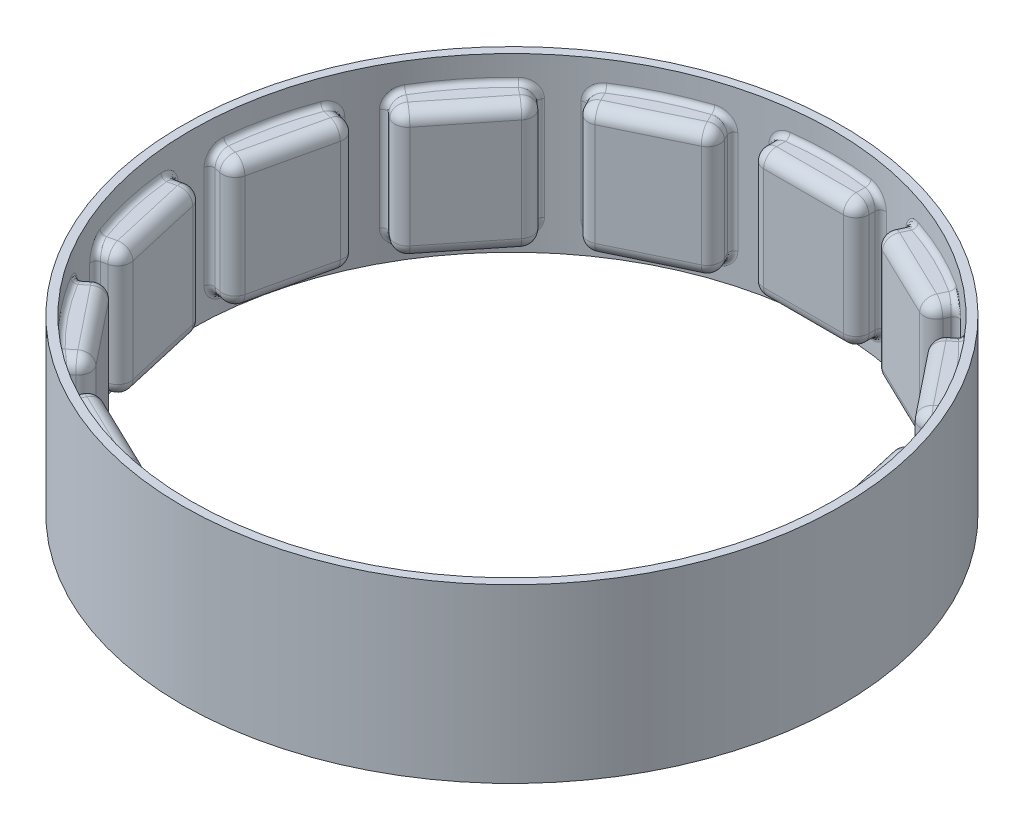
from build123d import *

# Parameters (mm, degrees)
SKETCH1_R           = 12.83
SKETCH1_R_2         = 12.5
BOSS_EXTRUDE1_DEPTH = 6.7
BOSS_EXTRUDE2_START = -1
SKETCH2_W           = 4.1
SKETCH2_H           = 1.2
BOSS_EXTRUDE2_DEPTH = 5
FILLET1_R           = 0.5
CIRPATTERN1_COUNT   = 14
FILLET2_R           = 0.2


with BuildPart() as part:
    # Sketch1 → Boss-Extrude1 (new body)
    with BuildSketch(Plane(origin=(0, 0, 0), x_dir=(1, 0, 0), z_dir=(0, 1, 0))):
        Circle(SKETCH1_R)
        Circle(SKETCH1_R_2, mode=Mode.SUBTRACT)
    extrude(amount=BOSS_EXTRUDE1_DEPTH)


with BuildPart() as body_2:
    # Sketch2 → Boss-Extrude2 (new body)
    with BuildSketch(Plane(origin=(0, 6.7, 0), x_dir=(1, 0, 0), z_dir=(0, 1, 0)).offset(BOSS_EXTRUDE2_START)):
        with Locations((0, 11.949163809)):
            Rectangle(SKETCH2_W, SKETCH2_H)
    extrude(amount=-BOSS_EXTRUDE2_DEPTH)

    # Fillet1
    fillet1_edges = [body_2.edges().sort_by_distance(p)[0] for p in [
        (2.05, 3.2, -11.349163809),
        (0, 0.7, -11.349163809),
        (-2.05, 3.2, -11.349163809),
        (0, 5.7, -11.349163809),
        (-2.05, 0.7, -11.949163809),
        (-2.05, 5.7, -11.949163809),
        (2.05, 0.7, -11.949163809),
        (2.05, 5.7, -11.949163809),
    ]]
    fillet(fillet1_edges, radius=FILLET1_R)


with BuildPart() as cirpattern1_1:
    # CirPattern1: pattern copy
    add(body_2.part.rotate(Axis((0, 6.7, 0), (0, -1, 0)), 1 * 360 / CIRPATTERN1_COUNT))


with BuildPart() as cirpattern1_2:
    # CirPattern1: pattern copy
    add(body_2.part.rotate(Axis((0, 6.7, 0), (0, -1, 0)), 2 * 360 / CIRPATTERN1_COUNT))


with BuildPart() as cirpattern1_3:
    # CirPattern1: pattern copy
    add(body_2.part.rotate(Axis((0, 6.7, 0), (0, -1, 0)), 3 * 360 / CIRPATTERN1_COUNT))


with BuildPart() as cirpattern1_4:
    # CirPattern1: pattern copy
    add(body_2.part.rotate(Axis((0, 6.7, 0), (0, -1, 0)), 4 * 360 / CIRPATTERN1_COUNT))


with BuildPart() as cirpattern1_5:
    # CirPattern1: pattern copy
    add(body_2.part.rotate(Axis((0, 6.7, 0), (0, -1, 0)), 5 * 360 / CIRPATTERN1_COUNT))


with BuildPart() as cirpattern1_6:
    # CirPattern1: pattern copy
    add(body_2.part.rotate(Axis((0, 6.7, 0), (0, -1, 0)), 6 * 360 / CIRPATTERN1_COUNT))


with BuildPart() as cirpattern1_7:
    # CirPattern1: pattern copy
    add(body_2.part.rotate(Axis((0, 6.7, 0), (0, -1, 0)), 7 * 360 / CIRPATTERN1_COUNT))


with BuildPart() as cirpattern1_8:
    # CirPattern1: pattern copy
    add(body_2.part.rotate(Axis((0, 6.7, 0), (0, -1, 0)), 8 * 360 / CIRPATTERN1_COUNT))


with BuildPart() as cirpattern1_9:
    # CirPattern1: pattern copy
    add(body_2.part.rotate(Axis((0, 6.7, 0), (0, -1, 0)), 9 * 360 / CIRPATTERN1_COUNT))


with BuildPart() as cirpattern1_10:
    # CirPattern1: pattern copy
    add(body_2.part.rotate(Axis((0, 6.7, 0), (0, -1, 0)), 10 * 360 / CIRPATTERN1_COUNT))


with BuildPart() as cirpattern1_11:
    # CirPattern1: pattern copy
    add(body_2.part.rotate(Axis((0, 6.7, 0), (0, -1, 0)), 11 * 360 / CIRPATTERN1_COUNT))


with BuildPart() as cirpattern1_12:
    # CirPattern1: pattern copy
    add(body_2.part.rotate(Axis((0, 6.7, 0), (0, -1, 0)), 12 * 360 / CIRPATTERN1_COUNT))


with BuildPart() as cirpattern1_13:
    # CirPattern1: pattern copy
    add(body_2.part.rotate(Axis((0, 6.7, 0), (0, -1, 0)), 13 * 360 / CIRPATTERN1_COUNT))


with BuildPart() as body_2_1:
    add(body_2.part)

    # Combine4: union part, CirPattern1_11, CirPattern1_10, CirPattern1_9, CirPattern1_8, CirPattern1_7, CirPattern1_6, CirPattern1_5, CirPattern1_4, CirPattern1_3, CirPattern1_2, CirPattern1_1, CirPattern1_12, CirPattern1_13
    add(part.part)
    add(cirpattern1_11.part)
    add(cirpattern1_10.part)
    add(cirpattern1_9.part)
    add(cirpattern1_8.part)
    add(cirpattern1_7.part)
    add(cirpattern1_6.part)
    add(cirpattern1_5.part)
    add(cirpattern1_4.part)
    add(cirpattern1_3.part)
    add(cirpattern1_2.part)
    add(cirpattern1_1.part)
    add(cirpattern1_12.part)
    add(cirpattern1_13.part)

    # Fillet2
    fillet2_edges = [body_2_1.edges().sort_by_distance(p)[0] for p in [
        (-12.186598902, 5.7, 2.781511674),
        (-11.565428567, 3.2, 4.742453169),
        (-11.621170197, 0.845677417, 4.604172375),
        (-12.186598902, 0.7, 2.781511674),
        (-12.467988082, 0.845677416, 0.894020805),
        (-12.477764396, 3.2, 0.745248729),
        (-12.467988082, 5.554322584, 0.894020805),
        (-12.186598902, 5.7, -2.781511674),
        (-12.477764396, 3.2, -0.745248729),
        (-12.467988082, 0.845677417, -0.894020806),
        (-12.186598902, 0.7, -2.781511674),
        (-11.621170197, 0.845677416, -4.604172375),
        (-11.565428567, 3.2, -4.742453169),
        (-11.621170197, 5.554322584, -4.604172375),
        (0, 5.7, -12.5),
        (2.05, 3.2, -12.330754235),
        (1.902782515, 0.845677417, -12.354327935),
        (0, 0.7, -12.5),
        (-1.902782515, 0.845677416, -12.354327935),
        (-2.05, 3.2, -12.330754235),
        (-1.902782515, 5.554322584, -12.354327935),
        (3.64599419, 5.554322584, -11.956451245),
        (3.503127574, 3.2, -11.999087349),
        (3.64599419, 0.845677416, -11.956451245),
        (5.423546739, 0.7, -11.262110849),
        (7.074689807, 0.845677417, -10.305278461),
        (7.197099933, 3.2, -10.220164018),
        (7.074689807, 5.554322583, -10.305278461),
        (8.47263703, 5.554322584, -9.190452751),
        (8.36241777, 3.2, -9.290854054),
        (8.47263703, 0.845677416, -9.190452751),
        (9.772893531, 0.7, -7.793622523),
        (10.845368017, 0.845677417, -6.215142201),
        (10.918725957, 3.2, -6.085344976),
        (10.845368017, 5.554322583, -6.215142201),
        (12.186598902, 5.7, -2.781511674),
        (11.565428567, 3.2, -4.742453169),
        (11.621170197, 0.845677416, -4.604172375),
        (12.186598902, 0.7, -2.781511674),
        (12.467988082, 0.845677417, -0.894020806),
        (12.477764396, 3.2, -0.745248729),
        (12.467988082, 5.554322583, -0.894020806),
        (12.186598902, 5.7, 2.781511674),
        (12.477764396, 3.2, 0.745248729),
        (12.467988082, 0.845677416, 0.894020805),
        (12.186598902, 0.7, 2.781511674),
        (11.621170197, 0.845677417, 4.604172375),
        (11.565428567, 3.2, 4.742453169),
        (11.621170197, 5.554322583, 4.604172375),
        (-8.472637031, 5.554322583, 9.190452751),
        (-8.36241777, 3.2, 9.290854054),
        (-8.472637031, 0.845677417, 9.190452751),
        (-9.772893531, 0.7, 7.793622523),
        (-10.845368017, 0.845677416, 6.215142201),
        (-10.918725957, 3.2, 6.085344976),
        (-10.845368017, 5.554322584, 6.215142201),
        (-3.64599419, 5.554322583, 11.956451245),
        (-3.503127574, 3.2, 11.999087349),
        (-3.64599419, 0.845677417, 11.956451245),
        (-5.423546739, 0.7, 11.262110849),
        (-7.074689807, 0.845677416, 10.30527846),
        (-7.197099933, 3.2, 10.220164018),
        (-7.074689807, 5.554322584, 10.30527846),
        (0, 5.7, 12.5),
        (-1.902782515, 5.554322584, 12.354327935),
        (-2.05, 3.2, 12.330754235),
        (-1.902782515, 0.845677416, 12.354327935),
        (0, 0.7, 12.5),
        (1.902782515, 0.845677417, 12.354327935),
        (2.05, 3.2, 12.330754235),
        (9.772893531, 5.7, 7.793622523),
        (8.472637031, 5.554322583, 9.190452751),
        (8.36241777, 3.2, 9.290854054),
        (8.472637031, 0.845677417, 9.190452751),
        (9.772893531, 0.7, 7.793622523),
        (10.845368017, 0.845677416, 6.215142201),
        (10.918725957, 3.2, 6.085344976),
        (7.074689807, 5.554322583, 10.305278461),
        (5.423546739, 5.7, 11.262110849),
        (3.64599419, 5.554322584, 11.956451245),
        (3.503127574, 3.2, 11.999087349),
        (3.64599419, 0.845677416, 11.956451245),
        (5.423546739, 0.7, 11.262110849),
        (7.074689807, 0.845677417, 10.305278461),
        (-12.186598902, 5.7, 2.781511674),
        (-12.186598902, 5.7, -2.781511674),
        (0, 5.7, -12.5),
        (5.423546739, 5.7, -11.262110849),
        (9.772893531, 5.7, -7.793622523),
        (12.186598902, 5.7, -2.781511674),
        (12.186598902, 5.7, 2.781511674),
        (-9.772893531, 5.7, 7.793622523),
        (-5.423546739, 5.7, 11.262110849),
        (0, 5.7, 12.5),
        (10.845368017, 5.554322584, 6.215142201),
        (7.197099933, 3.2, 10.220164018),
        (-7.074689807, 0.845677416, -10.30527846),
        (-7.197099933, 3.2, -10.220164018),
        (-7.074689807, 5.554322584, -10.30527846),
        (-5.423546739, 5.7, -11.262110849),
        (-3.64599419, 5.554322583, -11.956451245),
        (-3.503127574, 3.2, -11.999087349),
        (-3.64599419, 0.845677417, -11.956451245),
        (-10.845368017, 0.845677417, -6.215142201),
        (-10.918725957, 3.2, -6.085344976),
        (-10.845368017, 5.554322583, -6.215142201),
        (-9.772893531, 5.7, -7.793622523),
        (-8.47263703, 5.554322584, -9.190452751),
        (-8.36241777, 3.2, -9.290854054),
        (-8.47263703, 0.845677416, -9.190452751),
        (-5.423546739, 0.7, -11.262110849),
        (-9.772893531, 0.7, -7.793622523),
    ]]
    fillet(fillet2_edges, radius=FILLET2_R)


solid = body_2_1.part
